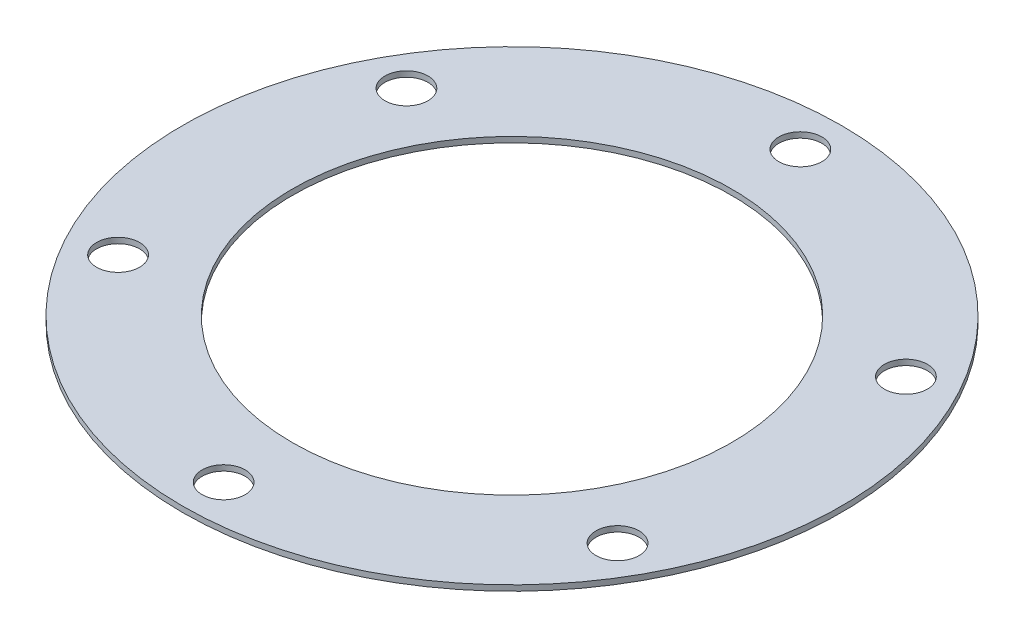
from build123d import *

# Parameters (mm, degrees)
SKETCH1_R           = 50.8
SKETCH1_R_2         = 3.3147
SKETCH1_R_3         = 33.8636
BOSS_EXTRUDE1_DEPTH = 0.8636


with BuildPart() as part:
    # Sketch1 → Boss-Extrude1 (new body)
    with BuildSketch(Plane(origin=(0, 0, 0), x_dir=(1, 0, 0), z_dir=(0, 1, 0))):
        Circle(SKETCH1_R)
        with Locations((-38.494829198, -22.225)):
            Circle(SKETCH1_R_2, mode=Mode.SUBTRACT)
        Circle(SKETCH1_R_3, mode=Mode.SUBTRACT)
        with Locations((0, -44.45)):
            Circle(SKETCH1_R_2, mode=Mode.SUBTRACT)
        with Locations((38.494829198, -22.225)):
            Circle(SKETCH1_R_2, mode=Mode.SUBTRACT)
        with Locations((-38.494829198, 22.225)):
            Circle(SKETCH1_R_2, mode=Mode.SUBTRACT)
        with Locations((0, 44.45)):
            Circle(SKETCH1_R_2, mode=Mode.SUBTRACT)
        with Locations((38.494829198, 22.225)):
            Circle(SKETCH1_R_2, mode=Mode.SUBTRACT)
    extrude(amount=BOSS_EXTRUDE1_DEPTH)


solid = part.part
